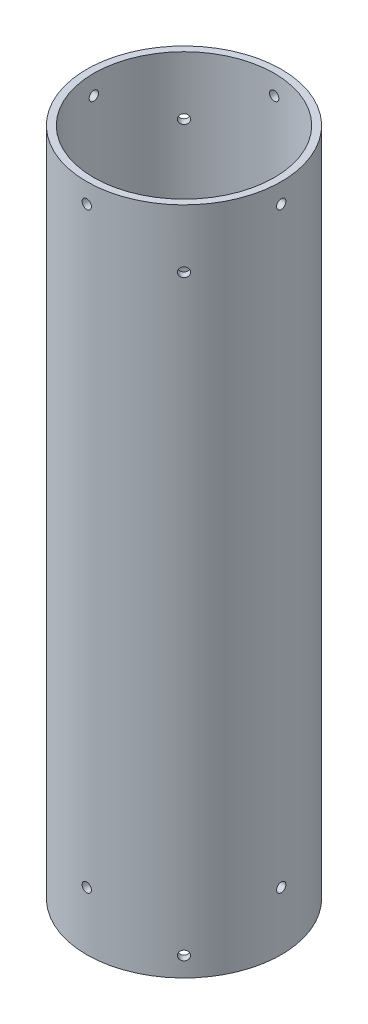
from build123d import *

# Parameters (mm, degrees)
SKETCH_1_R               = 25
SKETCH_1_R_2             = 23.2
EXTRUDE_1_DEPTH          = 172
SKETCH_3_R               = 1.2
CUT_EXTRUDE_2_DEPTH      = 176.59612752
PATTERN_CIRCULAR_1_COUNT = 4
SKETCH_11_R              = 1.2
CUT_EXTRUDE_10_DEPTH     = 176.596127648
PATTERN_CIRCULAR_2_COUNT = 4


with BuildPart() as part:
    # Эскиз1 → Бобышка-Вытянуть1 (new body)
    with BuildSketch(Plane(origin=(0, 0, 0), x_dir=(1, 0, 0), z_dir=(0, 1, 0))):
        Circle(SKETCH_1_R)
        Circle(SKETCH_1_R_2, mode=Mode.SUBTRACT)
    extrude(amount=EXTRUDE_1_DEPTH)

    # Эскиз3 → Вырез-Вытянуть2 (cut, through all)
    with BuildSketch(Plane(origin=(0, 0, 0), x_dir=(0, 0, -1), z_dir=(1, 0, 0))):
        with Locations((0, 167)):
            Circle(SKETCH_3_R)
        with Locations((0, 15)):
            Circle(SKETCH_3_R)
    cut_extrude_2 = extrude(amount=-CUT_EXTRUDE_2_DEPTH, mode=Mode.SUBTRACT)

    # Круговой массив1: Вырез-Вытянуть2 ×4 about axis
    pattern_circular_1_axis = Axis((0, 172, 0), (0, -1, 0))
    for i in range(1, PATTERN_CIRCULAR_1_COUNT):
        add(cut_extrude_2.rotate(pattern_circular_1_axis, i * 360 / PATTERN_CIRCULAR_1_COUNT), mode=Mode.SUBTRACT)

    # Эскиз11 → Вырез-Вытянуть10 (cut, through all)
    with BuildSketch(Plane(origin=(0, 0, 0), x_dir=(0, -1, 0), z_dir=(-0.7071067811865488, 0, 0.7071067811865464))):
        with Locations((-5, 0)):
            Circle(SKETCH_11_R)
        with Locations((-157, 0)):
            Circle(SKETCH_11_R)
    cut_extrude_10 = extrude(amount=-CUT_EXTRUDE_10_DEPTH, mode=Mode.SUBTRACT)

    # Круговой массив2: Вырез-Вытянуть10 ×4 about axis
    pattern_circular_2_axis = Axis((0, 172, 0), (0, -1, 0))
    for i in range(1, PATTERN_CIRCULAR_2_COUNT):
        add(cut_extrude_10.rotate(pattern_circular_2_axis, i * 360 / PATTERN_CIRCULAR_2_COUNT), mode=Mode.SUBTRACT)


solid = part.part
